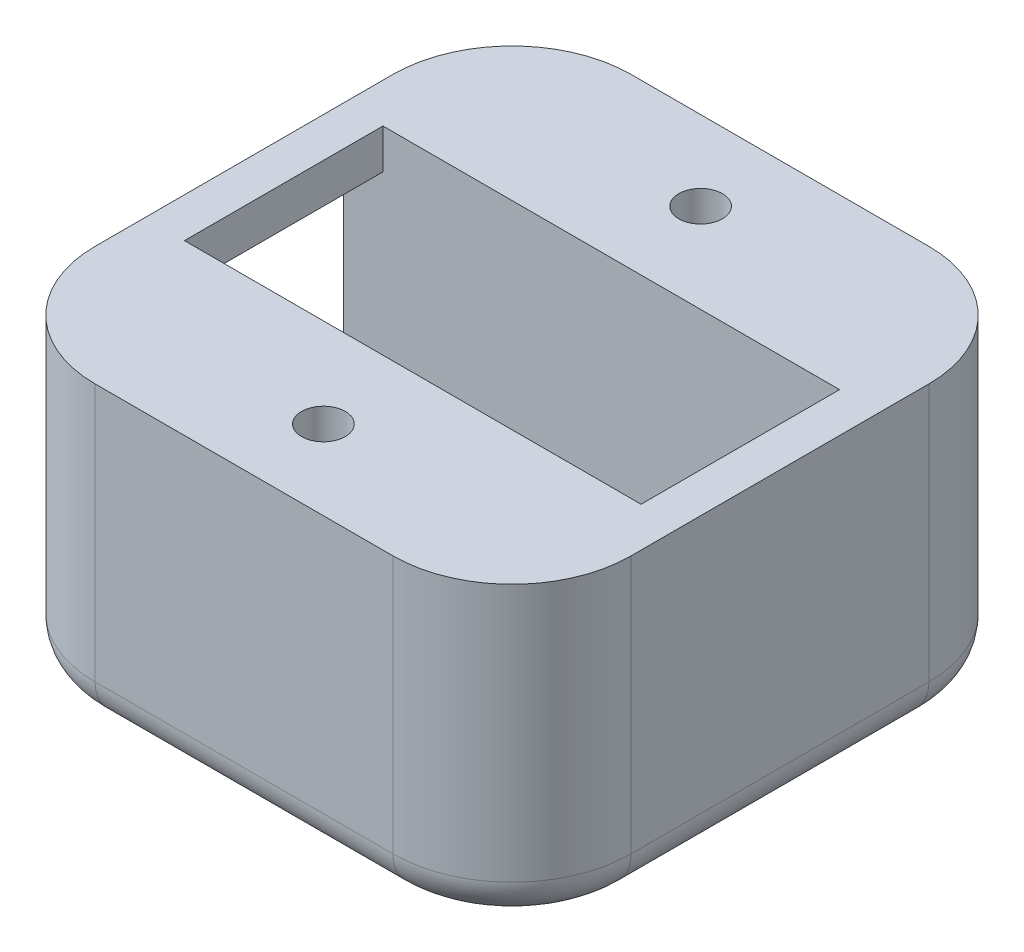
from build123d import *

# Parameters (mm, degrees)
ESQUISSE1_W             = 27
ESQUISSE1_H             = 27
BOSS_EXTRU_1_DEPTH      = 15
ESQUISSE2_W             = 23
ESQUISSE2_H             = 10
ENL_V_MAT_EXTRU_1_DEPTH = 13
ESQUISSE3_W             = 5
ESQUISSE3_H             = 10
BOSS_EXTRU_2_DEPTH      = 2.2
ESQUISSE4_R             = 0.8
ENL_V_MAT_EXTRU_2_DEPTH = 22.934903693
ENL_V_MAT_EXTRU_3_REACH = 34.129
ESQUISSE5_W             = 10
ESQUISSE5_H             = 11
ENL_V_MAT_EXTRU_4_REACH = 25.098
ESQUISSE6_W             = 2
ESQUISSE6_H             = 10
ESQUISSE7_R             = 1.1
ENL_V_MAT_EXTRU_5_DEPTH = 25.279621084
ENL_V_MAT_EXTRU_6_DEPTH = 12.5
CONG_1_R                = 6
CONG_1_R_2              = 2


with BuildPart() as part:
    # Esquisse1 → Boss.-Extru.1 (new body)
    with BuildSketch(Plane(origin=(0, 0, 0), x_dir=(1, 0, 0), z_dir=(0, 1, 0))):
        Rectangle(ESQUISSE1_W, ESQUISSE1_H)
    extrude(amount=BOSS_EXTRU_1_DEPTH)

    # Esquisse2 → Enlèv. mat.-Extru.1 (cut)
    with BuildSketch(Plane(origin=(0, 15, 0), x_dir=(1, 0, 0), z_dir=(0, 1, 0))):
        Rectangle(ESQUISSE2_W, ESQUISSE2_H)
    extrude(amount=-ENL_V_MAT_EXTRU_1_DEPTH, mode=Mode.SUBTRACT)

    # Esquisse3 → Boss.-Extru.2 (add)
    with BuildSketch(Plane(origin=(0, 2, 0), x_dir=(1, 0, 0), z_dir=(0, 1, 0))):
        with Locations((9, 0)):
            Rectangle(ESQUISSE3_W, ESQUISSE3_H)
    extrude(amount=BOSS_EXTRU_2_DEPTH)

    # Esquisse4 → Enlèv. mat.-Extru.2 (cut, through all)
    with BuildSketch(Plane(origin=(0, 4.2, 0), x_dir=(1, 0, 0), z_dir=(0, 1, 0))):
        with Locations(Location((9, 0, 0), (0, 0, 270))):
            Circle(ESQUISSE4_R)
    extrude(amount=-ENL_V_MAT_EXTRU_2_DEPTH, mode=Mode.SUBTRACT)

    # Esquisse5 → Enlèv. mat.-Extru.3 (cut, up to next)
    with BuildSketch(Plane(origin=(-11.5, 0, 0), x_dir=(0, 0, -1), z_dir=(1, 0, 0)), mode=Mode.PRIVATE) as enl_v_mat_extru_3_sk1:
        with Locations((0, 7.5)):
            Rectangle(ESQUISSE5_W, ESQUISSE5_H)
    enl_v_mat_extru_3_tool1 = extrude(enl_v_mat_extru_3_sk1.sketch, amount=-ENL_V_MAT_EXTRU_3_REACH, mode=Mode.PRIVATE) & part.part
    add(enl_v_mat_extru_3_tool1.solids().sort_by_distance((-11.5, 7.5, 0))[0], mode=Mode.SUBTRACT)

    # Esquisse6 → Enlèv. mat.-Extru.4 (cut, up to next)
    with BuildSketch(Plane(origin=(0, 2, 0), x_dir=(1, 0, 0), z_dir=(0, 1, 0)), mode=Mode.PRIVATE) as enl_v_mat_extru_4_sk1:
        with Locations((-12.5, 0)):
            Rectangle(ESQUISSE6_W, ESQUISSE6_H)
    enl_v_mat_extru_4_tool1 = extrude(enl_v_mat_extru_4_sk1.sketch, amount=-ENL_V_MAT_EXTRU_4_REACH, mode=Mode.PRIVATE) & part.part
    add(enl_v_mat_extru_4_tool1.solids().sort_by_distance((-12.5, 2, 0))[0], mode=Mode.SUBTRACT)

    # Esquisse7 → Enlèv. mat.-Extru.5 (cut, through all)
    with BuildSketch(Plane(origin=(0, 15, 0), x_dir=(1, 0, 0), z_dir=(0, 1, 0))):
        with Locations(Location((0, -9.5, 0), (0, 0, 270))):
            Circle(ESQUISSE7_R)
        with Locations(Location((0, 9.5, 0), (0, 0, 270))):
            Circle(ESQUISSE7_R)
    extrude(amount=-ENL_V_MAT_EXTRU_5_DEPTH, mode=Mode.SUBTRACT)

    # Esquisse8 → Enlèv. mat.-Extru.6 (cut)
    with BuildSketch(Plane.XZ):
        Polygon((2.309401077, -9.5), (1.154700538, -7.5), (-1.154700538, -7.5), (-2.309401077, -9.5), (-1.154700538, -11.5), (1.154700538, -11.5), align=None)
        Polygon((2.309401077, 9.5), (1.154700538, 11.5), (-1.154700538, 11.5), (-2.309401077, 9.5), (-1.154700538, 7.5), (1.154700538, 7.5), align=None)
    extrude(amount=-ENL_V_MAT_EXTRU_6_DEPTH, mode=Mode.SUBTRACT)

    # Enlèv. mat.-Extru.7: read off the stored shape, not the designer's step
    # Enlèv. mat.-Extru.7: loft between two sections, ruled curve by curve
    enl_v_mat_extru_7_from = [
        Edge.make_line((2.771281292, 0, -9.5), (1.385640646, 0, -7.1)),
        Edge.make_line((1.385640646, 0, -7.1), (-1.385640646, 0, -7.1)),
        Edge.make_line((-1.385640646, 0, -7.1), (-2.771281292, 0, -9.5)),
        Edge.make_line((-2.771281292, 0, -9.5), (-1.385640646, 0, -11.9)),
        Edge.make_line((-1.385640646, 0, -11.9), (1.385640646, 0, -11.9)),
        Edge.make_line((1.385640646, 0, -11.9), (2.771281292, 0, -9.5)),
    ]
    enl_v_mat_extru_7_to = [
        Edge.make_line((2.309401077, 5.720266503, -9.5), (1.154700538, 5.720266503, -7.5)),
        Edge.make_line((1.154700538, 5.720266503, -7.5), (-1.154700538, 5.720266503, -7.5)),
        Edge.make_line((-1.154700538, 5.720266503, -7.5), (-2.309401077, 5.720266503, -9.5)),
        Edge.make_line((-2.309401077, 5.720266503, -9.5), (-1.154700538, 5.720266503, -11.5)),
        Edge.make_line((-1.154700538, 5.720266503, -11.5), (1.154700538, 5.720266503, -11.5)),
        Edge.make_line((1.154700538, 5.720266503, -11.5), (2.309401077, 5.720266503, -9.5)),
    ]
    enl_v_mat_extru_7 = Solid(Shell([*[Face.make_surface_from_curves(enl_v_mat_extru_7_from[k], enl_v_mat_extru_7_to[k]) for k in range(6)], Face(Wire(enl_v_mat_extru_7_from)), Face(Wire(enl_v_mat_extru_7_to))]))
    add(enl_v_mat_extru_7, mode=Mode.SUBTRACT)

    # Enl_v. mat.-Extru.7 2: loft between two sections, ruled curve by curve
    enl_v_mat_extru_7_2_from = [
        Edge.make_line((2.771281292, 0, 9.5), (1.385640646, 0, 11.9)),
        Edge.make_line((1.385640646, 0, 11.9), (-1.385640646, 0, 11.9)),
        Edge.make_line((-1.385640646, 0, 11.9), (-2.771281292, 0, 9.5)),
        Edge.make_line((-2.771281292, 0, 9.5), (-1.385640646, 0, 7.1)),
        Edge.make_line((-1.385640646, 0, 7.1), (1.385640646, 0, 7.1)),
        Edge.make_line((1.385640646, 0, 7.1), (2.771281292, 0, 9.5)),
    ]
    enl_v_mat_extru_7_2_to = [
        Edge.make_line((2.309401077, 5.720266503, 9.5), (1.154700538, 5.720266503, 11.5)),
        Edge.make_line((1.154700538, 5.720266503, 11.5), (-1.154700538, 5.720266503, 11.5)),
        Edge.make_line((-1.154700538, 5.720266503, 11.5), (-2.309401077, 5.720266503, 9.5)),
        Edge.make_line((-2.309401077, 5.720266503, 9.5), (-1.154700538, 5.720266503, 7.5)),
        Edge.make_line((-1.154700538, 5.720266503, 7.5), (1.154700538, 5.720266503, 7.5)),
        Edge.make_line((1.154700538, 5.720266503, 7.5), (2.309401077, 5.720266503, 9.5)),
    ]
    enl_v_mat_extru_7_2 = Solid(Shell([*[Face.make_surface_from_curves(enl_v_mat_extru_7_2_from[k], enl_v_mat_extru_7_2_to[k]) for k in range(6)], Face(Wire(enl_v_mat_extru_7_2_from)), Face(Wire(enl_v_mat_extru_7_2_to))]))
    add(enl_v_mat_extru_7_2, mode=Mode.SUBTRACT)

    # Congé1
    # the kernel refuses this fillet: 6, 2 mm, written as the material it takes off along each edge
    with BuildSketch(Plane(origin=(13.5, -15, -13.5), x_dir=(-1, 0, 0), z_dir=(0, 1, 0)), Plane(origin=(13.5, -15, 13.5), x_dir=(0, 0, -1), z_dir=(0, 1, 0))) as cong_1_piece_1:
        with BuildLine():
            CenterArc((CONG_1_R, CONG_1_R), CONG_1_R, 180, 90)
            Line((0, CONG_1_R), (0, 0))
            Line((0, 0), (CONG_1_R, 0))
        make_face()
    extrude(amount=45, mode=Mode.SUBTRACT)
    with BuildSketch(Plane(origin=(-13.5, -15, 13.5), x_dir=(0, 0, -1), z_dir=(0, 1, 0)), Plane(origin=(-13.5, -15, -13.5), x_dir=(1, 0, 0), z_dir=(0, 1, 0))) as cong_1_piece_2:
        with BuildLine():
            CenterArc((CONG_1_R, -CONG_1_R), CONG_1_R, 90, 90)
            Line((0, -CONG_1_R), (0, 0))
            Line((0, 0), (CONG_1_R, 0))
        make_face()
    extrude(amount=45, mode=Mode.SUBTRACT)
    with BuildSketch(Plane(origin=(-11.5, 0, -5), x_dir=(1, 0, 0), z_dir=(0, 0, 1))) as cong_1_piece_3:
        with BuildLine():
            CenterArc((CONG_1_R_2, CONG_1_R_2), CONG_1_R_2, 180, 90)
            Line((0, CONG_1_R_2), (0, 0))
            Line((0, 0), (CONG_1_R_2, 0))
        make_face()
    extrude(amount=10, mode=Mode.SUBTRACT)
    # the kernel refuses this fillet: 6, 2 mm, written as the material it takes off along each edge
    with BuildSketch(Plane(origin=(13.5, 0, -7.5), x_dir=(0, 1, 0), z_dir=(0, 0, 1)), Plane(origin=(-7.5, 0, -13.5), x_dir=(0, 1, 0), z_dir=(1, 0, 0)), Plane(origin=(7.5, 0, 13.5), x_dir=(0, 1, 0), z_dir=(-1, 0, 0))) as cong_1_2_piece_1:
        with BuildLine():
            CenterArc((CONG_1_R_2, CONG_1_R_2), CONG_1_R_2, 180, 90)
            Line((0, CONG_1_R_2), (0, 0))
            Line((0, 0), (CONG_1_R_2, 0))
        make_face()
    extrude(amount=15, mode=Mode.SUBTRACT)
    with BuildSketch(Plane(origin=(-13.5, 0, 0), x_dir=(0, 1, 0), z_dir=(0, 0, -1)), Plane(origin=(-13.5, 0, 7.5), x_dir=(0, 1, 0), z_dir=(0, 0, -1))) as cong_1_2_piece_2:
        with BuildLine():
            CenterArc((CONG_1_R_2, CONG_1_R_2), CONG_1_R_2, 180, 90)
            Line((0, CONG_1_R_2), (0, 0))
            Line((0, 0), (CONG_1_R_2, 0))
        make_face()
    extrude(amount=7.5, mode=Mode.SUBTRACT)
    with BuildSketch(Plane(origin=(-7.5, 0, 7.5), x_dir=(0, 0, 1), z_dir=(1, 0, 0))) as cong_1_2_piece_3:
        with BuildLine():
            CenterArc((6 - CONG_1_R_2, -CONG_1_R_2), CONG_1_R_2, 0, 90)
            Line((6 - CONG_1_R_2, 0), (6, 0))
            Line((6, 0), (6, -CONG_1_R_2))
        make_face()
    revolve(axis=Axis((-7.5, 0, 7.5), (0, -1, 0)), revolution_arc=90, mode=Mode.SUBTRACT)
    with BuildSketch(Plane(origin=(-7.5, 0, -7.5), x_dir=(-1, 0, 0), z_dir=(0, 0, 1))) as cong_1_2_piece_4:
        with BuildLine():
            CenterArc((6 - CONG_1_R_2, -CONG_1_R_2), CONG_1_R_2, 0, 90)
            Line((6 - CONG_1_R_2, 0), (6, 0))
            Line((6, 0), (6, -CONG_1_R_2))
        make_face()
    revolve(axis=Axis((-7.5, 0, -7.5), (0, -1, 0)), revolution_arc=90, mode=Mode.SUBTRACT)
    with BuildSketch(Plane(origin=(7.5, 0, 7.5), x_dir=(1, 0, 0), z_dir=(0, 0, -1))) as cong_1_2_piece_5:
        with BuildLine():
            CenterArc((6 - CONG_1_R_2, -CONG_1_R_2), CONG_1_R_2, 0, 90)
            Line((6 - CONG_1_R_2, 0), (6, 0))
            Line((6, 0), (6, -CONG_1_R_2))
        make_face()
    revolve(axis=Axis((7.5, 0, 7.5), (0, -1, 0)), revolution_arc=90, mode=Mode.SUBTRACT)
    with BuildSketch(Plane(origin=(7.5, 0, -7.5), x_dir=(0, 0, -1), z_dir=(-1, 0, 0))) as cong_1_2_piece_6:
        with BuildLine():
            CenterArc((6 - CONG_1_R_2, -CONG_1_R_2), CONG_1_R_2, 0, 90)
            Line((6 - CONG_1_R_2, 0), (6, 0))
            Line((6, 0), (6, -CONG_1_R_2))
        make_face()
    revolve(axis=Axis((7.5, 0, -7.5), (0, -1, 0)), revolution_arc=90, mode=Mode.SUBTRACT)


solid = part.part
